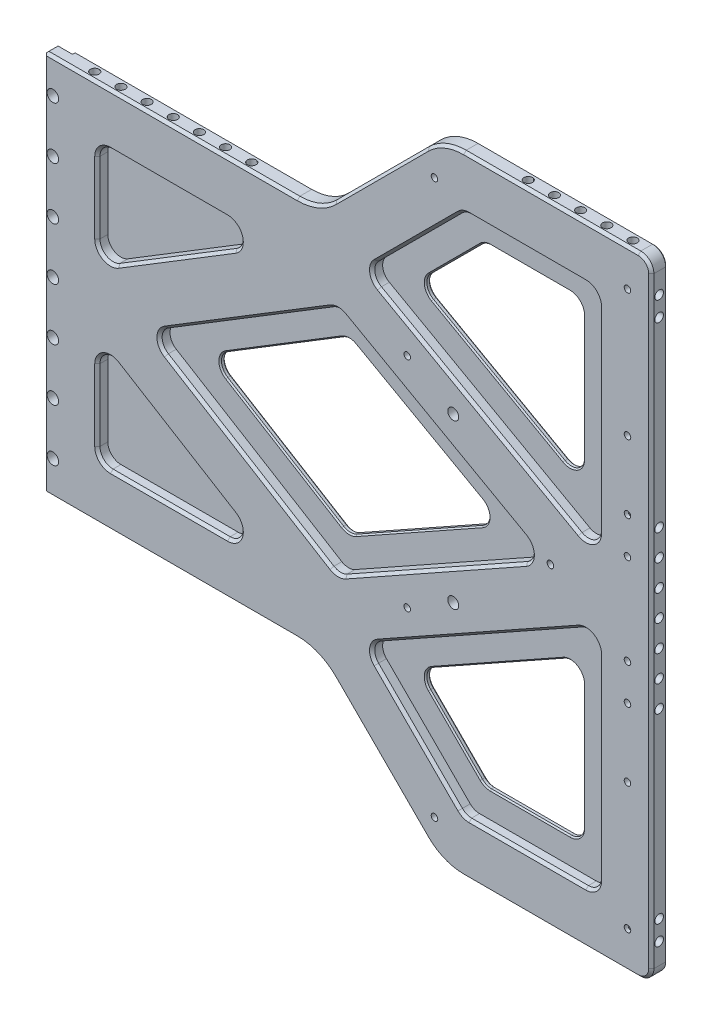
from build123d import *

# Parameters (mm, degrees)
EXTRUDE_1_DEPTH             = 1
EXTRUDE_2_DEPTH             = 5
FILLET_1_R                  = 20
CUT_EXTRUDE_1_DEPTH         = 4
FILLET_2_R                  = 5
CUT_EXTRUDE_2_DEPTH         = 5
FILLET_3_R                  = 5
FILLET_4_R                  = 5
CHAMFER_1_SIZE              = 1
CHAMFER_2_SIZE              = 1
CUT_EXTRUDE_3_DEPTH         = 266.872881163
CUT_EXTRUDE_3_DEPTH_BACK    = 266.872881163
SKETCH_5_R                  = 2.2
HOLE_WIZARD_M4_1_AT_2_COUNT = 2
HOLE_WIZARD_M4_1_AT_2_PITCH = 10
HOLE_WIZARD_M4_1_AT_3_COUNT = 2
HOLE_WIZARD_M4_1_AT_3_PITCH = 20
HOLE_WIZARD_M4_1_AT_4_COUNT = 2
HOLE_WIZARD_M4_1_AT_4_PITCH = 30
HOLE_WIZARD_M4_1_AT_5_COUNT = 2
HOLE_WIZARD_M4_1_AT_5_PITCH = 40
HOLE_WIZARD_M4_1_AT_6_COUNT = 2
HOLE_WIZARD_M4_1_AT_6_PITCH = 50
HOLE_WIZARD_M4_1_AT_7_COUNT = 2
HOLE_WIZARD_M4_1_AT_7_PITCH = 60
HOLE_WIZARD_M4_2_AT_2_COUNT = 2
HOLE_WIZARD_M4_2_AT_2_PITCH = 10
HOLE_WIZARD_M4_2_AT_3_COUNT = 2
HOLE_WIZARD_M4_2_AT_3_PITCH = 20
HOLE_WIZARD_M4_2_AT_4_COUNT = 2
HOLE_WIZARD_M4_2_AT_4_PITCH = 30
HOLE_WIZARD_M4_2_AT_5_COUNT = 2
HOLE_WIZARD_M4_2_AT_5_PITCH = 40
HOLE_WIZARD_M4_3_AT_2_COUNT = 2
HOLE_WIZARD_M4_3_AT_2_PITCH = 7.5
HOLE_WIZARD_M5_1_D          = 4.2
HOLE_WIZARD_M5_1_DEPTH      = 12.4
HOLE_WIZARD_M5_1_TIP        = 1.2618073
HOLE_WIZARD_M4_4_D          = 3.3
HOLE_WIZARD_M4_4_DEPTH      = 10.1
HOLE_WIZARD_M4_4_TIP        = 0.991420021
HOLE_WIZARD_M3_1_AT_2_COUNT = 2
HOLE_WIZARD_M3_1_AT_2_PITCH = 64.972623466
HOLE_WIZARD_M3_1_AT_3_COUNT = 2
HOLE_WIZARD_M3_1_AT_3_PITCH = 68.85714545
HOLE_WIZARD_M3_1_AT_4_COUNT = 2
HOLE_WIZARD_M3_1_AT_4_PITCH = 84.831082157
HOLE_WIZARD_M3_1_AT_5_COUNT = 2
HOLE_WIZARD_M3_1_AT_5_PITCH = 87.639356456
HOLE_WIZARD_M3_1_AT_6_COUNT = 2
HOLE_WIZARD_M3_1_AT_6_PITCH = 105.831054044
HOLE_WIZARD_M3_1_AT_7_COUNT = 2
HOLE_WIZARD_M3_1_AT_7_PITCH = 85.616918889
CHAMFER_3_SIZE              = 0.5
CHAMFER_5_SIZE              = 0.5


with BuildPart() as part:
    # 草图1 → 凸台-拉伸1 (new body)
    with BuildSketch(Plane.XY):
        Polygon((11.5, 73), (110.175860782, 73), (157.175860782, 120), (237.175860782, 120), (237.175860782, -120), (157.175860782, -120), (110.175860782, -73), (11.5, -73), align=None)
    extrude(amount=-EXTRUDE_1_DEPTH)

    # 草图2 → 凸台-拉伸2 (add)
    with BuildSketch(Plane.XY):
        Polygon((11.5, 73), (5.5, 73), (5.5, -73), (11.5, -73), (110.175860782, -73), (157.175860782, -120), (237.175860782, -120), (237.175860782, 120), (157.175860782, 120), (110.175860782, 73), align=None)
    extrude(amount=EXTRUDE_2_DEPTH)

    # 圆角1
    fillet_1_edges = [part.edges().sort_by_distance(p)[0] for p in [
        (110.175860782, 73, 2),
        (157.175860782, 120, 2),
        (157.175860782, -120, 2),
        (110.175860782, -73, 2),
    ]]
    fillet(fillet_1_edges, radius=FILLET_1_R)

    # 草图3 → 切除-拉伸1 (cut)
    with BuildSketch(Plane.XY.offset(5)):
        Polygon((196.725411073, 0), (117.41720526, -44.458394956), (44.675653042, 0), (117.41720526, 44.458394956), align=None)
        with BuildLine():
            Line((127.111323554, 61.952213992), (217.175860782, 11.464061769))
            Line((217.175860782, 11.464061769), (217.175860782, 100))
            Line((217.175860782, 100), (165.46013203, 100))
            Line((165.46013203, 100), (130.175860782, 64.715728753))
            ThreePointArc((130.175860782, 64.715728753), (128.679252709, 63.294426421), (127.111323554, 61.952213992))
        make_face()
        with BuildLine():
            Line((217.175860782, -100), (217.175860782, -11.464061769))
            Line((217.175860782, -11.464061769), (127.111323554, -61.952213992))
            ThreePointArc((127.111323554, -61.952213992), (128.679252709, -63.294426421), (130.175860782, -64.715728752))
            Line((130.175860782, -64.715728752), (165.46013203, -100))
            Line((165.46013203, -100), (217.175860782, -100))
        make_face()
        Polygon((25.5, -53), (93.041428657, -53), (25.5, -11.719831794), align=None)
        Polygon((25.5, 11.719831794), (93.041428657, 53), (25.5, 53), align=None)
    extrude(amount=-CUT_EXTRUDE_1_DEPTH, mode=Mode.SUBTRACT)

    # 圆角2
    fillet_2_edges = [part.edges().sort_by_distance(p)[0] for p in [
        (165.46013203, -100, 3),
        (217.175860782, -100, 3),
        (217.175860782, -11.464061769, 3),
        (127.111323554, -61.952213992, 3),
        (217.175860782, 11.464061769, 3),
        (165.46013203, 100, 3),
        (127.111323554, 61.952213992, 3),
        (117.41720526, 44.458394956, 3),
        (44.675653042, 0, 3),
        (117.41720526, -44.458394956, 3),
        (196.725411073, 0, 3),
        (25.5, -53, 3),
        (93.041428657, -53, 3),
        (25.5, -11.719831794, 3),
        (25.5, 53, 3),
        (25.5, 11.719831794, 3),
        (93.041428657, 53, 3),
        (217.175860782, 100, 3),
    ]]
    fillet(fillet_2_edges, radius=FILLET_2_R)

    # 草图4 → 切除-拉伸2 (cut)
    with BuildSketch(Plane.XY.offset(1)):
        Polygon((176.274961364, 0), (117.635483691, 32.871971212), (63.851306084, 0), (117.635483691, -32.871971212), align=None)
        Polygon((143.712370298, 64.110102645), (207.175860782, 28.533898438), (207.175860782, 90), (169.602267653, 90), align=None)
        Polygon((143.712370298, -64.110102644), (169.602267653, -90), (207.175860782, -90), (207.175860782, -28.533898438), align=None)
    extrude(amount=-CUT_EXTRUDE_2_DEPTH, mode=Mode.SUBTRACT)

    # 圆角3
    fillet_3_edges = [part.edges().sort_by_distance(p)[0] for p in [
        (143.712370298, -64.110102644, 0),
        (207.175860782, -28.533898438, 0),
        (207.175860782, -90, 0),
        (169.602267653, -90, 0),
        (143.712370298, 64.110102645, 0),
        (169.602267653, 90, 0),
        (207.175860782, 90, 0),
        (207.175860782, 28.533898438, 0),
        (176.274961364, 0, 0),
        (117.635483691, -32.871971212, 0),
        (63.851306084, 0, 0),
        (117.635483691, 32.871971212, 0),
    ]]
    fillet(fillet_3_edges, radius=FILLET_3_R)

    # 圆角4
    fillet_4_edges = [part.edges().sort_by_distance(p)[0] for p in [
        (237.175860782, 120, 2),
        (237.175860782, -120, 2),
    ]]
    fillet(fillet_4_edges, radius=FILLET_4_R)

    # 倒角1
    chamfer_1_edges = [part.edges().sort_by_distance(p)[0] for p in [
        (189.853530312, -100, 5),
        (147.984212406, -82.524080377, 5),
        (217.175860782, -57.499490052, 5),
        (171.397142773, -37.126580608, 5),
        (217.175860782, 57.499490052, 5),
        (171.397142773, 37.126580608, 5),
        (147.984212406, 82.524080377, 5),
        (189.853530312, 100, 5),
        (83.287438892, 23.598864376, 5),
        (154.458199356, 23.694047456, 5),
        (83.287438892, -23.598864376, 5),
        (154.458199356, -23.694047456, 5),
        (52.886372686, -53, 5),
        (25.5, -34.317831169, 5),
        (55.493845813, -30.051558335, 5),
        (25.5, 34.317831169, 5),
        (52.886372686, 53, 5),
        (55.493845813, 30.051558335, 5),
        (165.61778268, -99.619397663, 5),
        (215.711394688, -98.535533906, 5),
        (214.703243811, -15.684778552, 5),
        (130.555302658, -62.293068947, 5),
        (214.703243811, 15.684778552, 5),
        (165.61778268, 99.619397663, 5),
        (130.555302658, 62.293068948, 5),
        (117.432165413, 43.664296036, 5),
        (49.263479563, 0, 5),
        (117.432165413, -43.664296036, 5),
        (191.500186218, 0, 5),
        (26.964466094, -51.535533906, 5),
        (80.08581945, -49.354369933, 5),
        (28.054326845, -16.274620854, 5),
        (26.964466094, 51.535533906, 5),
        (28.054326845, 16.274620854, 5),
        (80.085819451, 49.354369933, 5),
        (215.711394688, 98.535533906, 5),
    ]]
    chamfer(chamfer_1_edges, length=CHAMFER_1_SIZE)

    # 倒角2
    chamfer_2_edges = [part.edges().sort_by_distance(p)[0] for p in [
        (53.695794767, -73, 5),
        (237.175860782, 0, 5),
        (198.817996406, 120, 5),
        (235.711394688, -118.535533906, 5),
        (235.711394688, 118.535533906, 5),
        (56.695794768, 73, 5),
        (133.675860782, -96.5, 5),
        (198.817996406, -120, 5),
        (133.675860782, 96.5, 5),
        (157.806463382, -118.47759065, 5),
        (157.806463382, 118.47759065, 5),
        (109.545258182, -74.52240935, 5),
        (109.545258182, 74.52240935, 5),
    ]]
    chamfer(chamfer_2_edges, length=CHAMFER_2_SIZE)

    # 草图5 → 切除-拉伸3 (cut, two sides: drawn at the far end of the back side and taken through both)
    with BuildSketch(Plane.XY.offset(5).offset(-CUT_EXTRUDE_3_DEPTH_BACK)):
        with Locations((8.5, 60)):
            Circle(SKETCH_5_R)
        with Locations((8.5, 40)):
            Circle(SKETCH_5_R)
        with Locations((8.5, 20)):
            Circle(SKETCH_5_R)
        with Locations((8.5, 0)):
            Circle(SKETCH_5_R)
        with Locations((8.5, -20)):
            Circle(SKETCH_5_R)
        with Locations((8.5, -40)):
            Circle(SKETCH_5_R)
        with Locations((8.5, -60)):
            Circle(SKETCH_5_R)
    extrude(amount=CUT_EXTRUDE_3_DEPTH + CUT_EXTRUDE_3_DEPTH_BACK, mode=Mode.SUBTRACT)

    # 草图8 → M4 螺纹孔1 (revolve, cut)
    with BuildSketch(Plane(origin=(81.5, -73, 2), x_dir=(0, 0, -1), z_dir=(1, 0, 0))):
        Polygon((0, 0), (0, 11.091420021), (1.65, 10.1), (1.65, 0), align=None)
    hole_wizard_m4_1 = revolve(axis=Axis((81.5, -79.35, 2), (0, 1, 0)), mode=Mode.SUBTRACT)

    # M4 螺纹孔1 at 2: M4 螺纹孔1 ×2
    with Locations(*[(-i * HOLE_WIZARD_M4_1_AT_2_PITCH, 0, 0) for i in range(1, HOLE_WIZARD_M4_1_AT_2_COUNT)]):
        add(hole_wizard_m4_1, mode=Mode.SUBTRACT)

    # M4 螺纹孔1 at 3: M4 螺纹孔1 ×2
    with Locations(*[(-i * HOLE_WIZARD_M4_1_AT_3_PITCH, 0, 0) for i in range(1, HOLE_WIZARD_M4_1_AT_3_COUNT)]):
        add(hole_wizard_m4_1, mode=Mode.SUBTRACT)

    # M4 螺纹孔1 at 4: M4 螺纹孔1 ×2
    with Locations(*[(-i * HOLE_WIZARD_M4_1_AT_4_PITCH, 0, 0) for i in range(1, HOLE_WIZARD_M4_1_AT_4_COUNT)]):
        add(hole_wizard_m4_1, mode=Mode.SUBTRACT)

    # M4 螺纹孔1 at 5: M4 螺纹孔1 ×2
    with Locations(*[(-i * HOLE_WIZARD_M4_1_AT_5_PITCH, 0, 0) for i in range(1, HOLE_WIZARD_M4_1_AT_5_COUNT)]):
        add(hole_wizard_m4_1, mode=Mode.SUBTRACT)

    # M4 螺纹孔1 at 6: M4 螺纹孔1 ×2
    with Locations(*[(-i * HOLE_WIZARD_M4_1_AT_6_PITCH, 0, 0) for i in range(1, HOLE_WIZARD_M4_1_AT_6_COUNT)]):
        add(hole_wizard_m4_1, mode=Mode.SUBTRACT)

    # M4 螺纹孔1 at 7: M4 螺纹孔1 ×2
    with Locations(*[(-i * HOLE_WIZARD_M4_1_AT_7_PITCH, 0, 0) for i in range(1, HOLE_WIZARD_M4_1_AT_7_COUNT)]):
        add(hole_wizard_m4_1, mode=Mode.SUBTRACT)

    # 镜向1: M4 螺纹孔1 across plane
    add(hole_wizard_m4_1.mirror(Plane.ZX), mode=Mode.SUBTRACT)

    # 镜向1 copy 1 sketch → 镜向1 copy 1 (revolve, cut)
    with BuildSketch(Plane(origin=(71.5, 73, 2), x_dir=(0, 0, -1), z_dir=(1, 0, 0))):
        Polygon((0, 0), (0, -11.091420021), (1.65, -10.1), (1.65, 0), align=None)
    revolve(axis=Axis((71.5, 79.35, 2), (0, 1, 0)), mode=Mode.SUBTRACT)

    # 镜向1 copy 2 sketch → 镜向1 copy 2 (revolve, cut)
    with BuildSketch(Plane(origin=(61.5, 73, 2), x_dir=(0, 0, -1), z_dir=(1, 0, 0))):
        Polygon((0, 0), (0, -11.091420021), (1.65, -10.1), (1.65, 0), align=None)
    revolve(axis=Axis((61.5, 79.35, 2), (0, 1, 0)), mode=Mode.SUBTRACT)

    # 镜向1 copy 3 sketch → 镜向1 copy 3 (revolve, cut)
    with BuildSketch(Plane(origin=(51.5, 73, 2), x_dir=(0, 0, -1), z_dir=(1, 0, 0))):
        Polygon((0, 0), (0, -11.091420021), (1.65, -10.1), (1.65, 0), align=None)
    revolve(axis=Axis((51.5, 79.35, 2), (0, 1, 0)), mode=Mode.SUBTRACT)

    # 镜向1 copy 4 sketch → 镜向1 copy 4 (revolve, cut)
    with BuildSketch(Plane(origin=(41.5, 73, 2), x_dir=(0, 0, -1), z_dir=(1, 0, 0))):
        Polygon((0, 0), (0, -11.091420021), (1.65, -10.1), (1.65, 0), align=None)
    revolve(axis=Axis((41.5, 79.35, 2), (0, 1, 0)), mode=Mode.SUBTRACT)

    # 镜向1 copy 5 sketch → 镜向1 copy 5 (revolve, cut)
    with BuildSketch(Plane(origin=(31.5, 73, 2), x_dir=(0, 0, -1), z_dir=(1, 0, 0))):
        Polygon((0, 0), (0, -11.091420021), (1.65, -10.1), (1.65, 0), align=None)
    revolve(axis=Axis((31.5, 79.35, 2), (0, 1, 0)), mode=Mode.SUBTRACT)

    # 镜向1 copy 6 sketch → 镜向1 copy 6 (revolve, cut)
    with BuildSketch(Plane(origin=(21.5, 73, 2), x_dir=(0, 0, -1), z_dir=(1, 0, 0))):
        Polygon((0, 0), (0, -11.091420021), (1.65, -10.1), (1.65, 0), align=None)
    revolve(axis=Axis((21.5, 79.35, 2), (0, 1, 0)), mode=Mode.SUBTRACT)

    # 草图11 → M4 螺纹孔2 (revolve, cut)
    with BuildSketch(Plane(origin=(227.175860782, -120, 2), x_dir=(0, 0, -1), z_dir=(1, 0, 0))):
        Polygon((0, 0), (0, 11.091420021), (1.65, 10.1), (1.65, 0), align=None)
    hole_wizard_m4_2 = revolve(axis=Axis((227.175860782, -126.35, 2), (0, 1, 0)), mode=Mode.SUBTRACT)

    # M4 螺纹孔2 at 2: M4 螺纹孔2 ×2
    with Locations(*[(-i * HOLE_WIZARD_M4_2_AT_2_PITCH, 0, 0) for i in range(1, HOLE_WIZARD_M4_2_AT_2_COUNT)]):
        add(hole_wizard_m4_2, mode=Mode.SUBTRACT)

    # M4 螺纹孔2 at 3: M4 螺纹孔2 ×2
    with Locations(*[(-i * HOLE_WIZARD_M4_2_AT_3_PITCH, 0, 0) for i in range(1, HOLE_WIZARD_M4_2_AT_3_COUNT)]):
        add(hole_wizard_m4_2, mode=Mode.SUBTRACT)

    # M4 螺纹孔2 at 4: M4 螺纹孔2 ×2
    with Locations(*[(-i * HOLE_WIZARD_M4_2_AT_4_PITCH, 0, 0) for i in range(1, HOLE_WIZARD_M4_2_AT_4_COUNT)]):
        add(hole_wizard_m4_2, mode=Mode.SUBTRACT)

    # M4 螺纹孔2 at 5: M4 螺纹孔2 ×2
    with Locations(*[(-i * HOLE_WIZARD_M4_2_AT_5_PITCH, 0, 0) for i in range(1, HOLE_WIZARD_M4_2_AT_5_COUNT)]):
        add(hole_wizard_m4_2, mode=Mode.SUBTRACT)

    # 镜向2: M4 螺纹孔2 across plane
    add(hole_wizard_m4_2.mirror(Plane.ZX), mode=Mode.SUBTRACT)

    # 镜向2 copy 1 sketch → 镜向2 copy 1 (revolve, cut)
    with BuildSketch(Plane(origin=(217.175860782, 120, 2), x_dir=(0, 0, -1), z_dir=(1, 0, 0))):
        Polygon((0, 0), (0, -11.091420021), (1.65, -10.1), (1.65, 0), align=None)
    revolve(axis=Axis((217.175860782, 126.35, 2), (0, 1, 0)), mode=Mode.SUBTRACT)

    # 镜向2 copy 2 sketch → 镜向2 copy 2 (revolve, cut)
    with BuildSketch(Plane(origin=(207.175860782, 120, 2), x_dir=(0, 0, -1), z_dir=(1, 0, 0))):
        Polygon((0, 0), (0, -11.091420021), (1.65, -10.1), (1.65, 0), align=None)
    revolve(axis=Axis((207.175860782, 126.35, 2), (0, 1, 0)), mode=Mode.SUBTRACT)

    # 镜向2 copy 3 sketch → 镜向2 copy 3 (revolve, cut)
    with BuildSketch(Plane(origin=(197.175860782, 120, 2), x_dir=(0, 0, -1), z_dir=(1, 0, 0))):
        Polygon((0, 0), (0, -11.091420021), (1.65, -10.1), (1.65, 0), align=None)
    revolve(axis=Axis((197.175860782, 126.35, 2), (0, 1, 0)), mode=Mode.SUBTRACT)

    # 镜向2 copy 4 sketch → 镜向2 copy 4 (revolve, cut)
    with BuildSketch(Plane(origin=(187.175860782, 120, 2), x_dir=(0, 0, -1), z_dir=(1, 0, 0))):
        Polygon((0, 0), (0, -11.091420021), (1.65, -10.1), (1.65, 0), align=None)
    revolve(axis=Axis((187.175860782, 126.35, 2), (0, 1, 0)), mode=Mode.SUBTRACT)

    # 草图14 → M4 螺纹孔3 (revolve, cut)
    with BuildSketch(Plane(origin=(237.175860782, -99.5, 2), x_dir=(0, 0, -1), z_dir=(0, 1, 0))):
        Polygon((0, 0), (0, 11.091420021), (1.65, 10.1), (1.65, 0), align=None)
    hole_wizard_m4_3 = revolve(axis=Axis((243.525860782, -99.5, 2), (-1, 0, 0)), mode=Mode.SUBTRACT)

    # M4 螺纹孔3 at 2: M4 螺纹孔3 ×2
    with Locations(*[(0, -i * HOLE_WIZARD_M4_3_AT_2_PITCH, 0) for i in range(1, HOLE_WIZARD_M4_3_AT_2_COUNT)]):
        add(hole_wizard_m4_3, mode=Mode.SUBTRACT)

    # 镜向3: M4 螺纹孔3 across plane
    add(hole_wizard_m4_3.mirror(Plane.ZX), mode=Mode.SUBTRACT)

    # 镜向3 copy 1 sketch → 镜向3 copy 1 (revolve, cut)
    with BuildSketch(Plane(origin=(237.175860782, 107, 2), x_dir=(0, 0, -1), z_dir=(0, -1, 0))):
        Polygon((0, 0), (0, -11.091420021), (1.65, -10.1), (1.65, 0), align=None)
    revolve(axis=Axis((243.525860782, 107, 2), (1, 0, 0)), mode=Mode.SUBTRACT)

    # M5 螺纹孔1
    with Locations(Plane.XY.offset(5)):
        with Locations((161.5, 31.210634294), (161.5, -31.210634294)):
            Hole(HOLE_WIZARD_M5_1_D / 2, depth=HOLE_WIZARD_M5_1_DEPTH)
            with Locations((0, 0, -(HOLE_WIZARD_M5_1_DEPTH + HOLE_WIZARD_M5_1_TIP / 2))):  # 118° drill point
                Cone(0, HOLE_WIZARD_M5_1_D / 2, HOLE_WIZARD_M5_1_TIP, mode=Mode.SUBTRACT)

    # M4 螺纹孔4
    with Locations(Plane(origin=(237.175860782, 0, 0), x_dir=(0, 0, -1), z_dir=(1, 0, 0))):
        with Locations((-2, 30), (-2, 20), (-2, 10), (-2, 0), (-2, -10), (-2, -20), (-2, -30)):
            Hole(HOLE_WIZARD_M4_4_D / 2, depth=HOLE_WIZARD_M4_4_DEPTH)
            with Locations((0, 0, -(HOLE_WIZARD_M4_4_DEPTH + HOLE_WIZARD_M4_4_TIP / 2))):  # 118° drill point
                Cone(0, HOLE_WIZARD_M4_4_D / 2, HOLE_WIZARD_M4_4_TIP, mode=Mode.SUBTRACT)

    # 草图23 → M3 螺纹孔1 (revolve, cut)
    with BuildSketch(Plane(origin=(143.9, -41.700634294, 5), x_dir=(0, -1, 0), z_dir=(1, 0, 0))):
        Polygon((0, 0), (0, 8.251075774), (1.25, 7.5), (1.25, 0), align=None)
    hole_wizard_m3_1 = revolve(axis=Axis((143.9, -41.700634294, 11.35), (0, 0, -1)), mode=Mode.SUBTRACT)

    # M3 螺纹孔1 at 2: M3 螺纹孔1 ×2
    with Locations(*[Vector(0.1605291497198888, -0.98703109985968, 0) * (i * HOLE_WIZARD_M3_1_AT_2_PITCH) for i in range(1, HOLE_WIZARD_M3_1_AT_2_COUNT)]):
        add(hole_wizard_m3_1, mode=Mode.SUBTRACT)

    # M3 螺纹孔1 at 3: M3 螺纹孔1 ×2
    with Locations(*[Vector(0.7949792231794381, 0.606636657904068, 0) * (i * HOLE_WIZARD_M3_1_AT_3_PITCH) for i in range(1, HOLE_WIZARD_M3_1_AT_3_COUNT)]):
        add(hole_wizard_m3_1, mode=Mode.SUBTRACT)

    # M3 螺纹孔1 at 4: M3 螺纹孔1 ×2
    with Locations(*[Vector(0.9923249575407045, 0.12365750540035624, 0) * (i * HOLE_WIZARD_M3_1_AT_4_PITCH) for i in range(1, HOLE_WIZARD_M3_1_AT_4_COUNT)]):
        add(hole_wizard_m3_1, mode=Mode.SUBTRACT)

    # M3 螺纹孔1 at 5: M3 螺纹孔1 ×2
    with Locations(*[Vector(0.960527363552502, 0.2781855205917082, 0) * (i * HOLE_WIZARD_M3_1_AT_5_PITCH) for i in range(1, HOLE_WIZARD_M3_1_AT_5_COUNT)]):
        add(hole_wizard_m3_1, mode=Mode.SUBTRACT)

    # M3 螺纹孔1 at 6: M3 螺纹孔1 ×2
    with Locations(*[Vector(0.7954187054136518, -0.6060602965696321, 0) * (i * HOLE_WIZARD_M3_1_AT_6_PITCH) for i in range(1, HOLE_WIZARD_M3_1_AT_6_COUNT)]):
        add(hole_wizard_m3_1, mode=Mode.SUBTRACT)

    # M3 螺纹孔1 at 7: M3 螺纹孔1 ×2
    with Locations(*[Vector(0.9832168815768637, -0.18244057603029953, 0) * (i * HOLE_WIZARD_M3_1_AT_7_PITCH) for i in range(1, HOLE_WIZARD_M3_1_AT_7_COUNT)]):
        add(hole_wizard_m3_1, mode=Mode.SUBTRACT)

    # 镜向4: M3 螺纹孔1 across plane
    add(hole_wizard_m3_1.mirror(Plane.ZX), mode=Mode.SUBTRACT)

    # 镜向4 copy 1 sketch → 镜向4 copy 1 (revolve, cut)
    with BuildSketch(Plane(origin=(154.33, 105.830634294, 5), x_dir=(0, 1, 0), z_dir=(1, 0, 0))):
        Polygon((0, 0), (0, -8.251075774), (1.25, -7.5), (1.25, 0), align=None)
    revolve(axis=Axis((154.33, 105.830634294, 11.35), (0, 0, 1)), mode=Mode.SUBTRACT)

    # 镜向4 copy 2 sketch → 镜向4 copy 2 (revolve, cut)
    with BuildSketch(Plane(origin=(198.64, -0.070634294, 5), x_dir=(0, 1, 0), z_dir=(1, 0, 0))):
        Polygon((0, 0), (0, -8.251075774), (1.25, -7.5), (1.25, 0), align=None)
    revolve(axis=Axis((198.64, -0.070634294, 11.35), (0, 0, 1)), mode=Mode.SUBTRACT)

    # 镜向4 copy 3 sketch → 镜向4 copy 3 (revolve, cut)
    with BuildSketch(Plane(origin=(228.08, 31.210634294, 5), x_dir=(0, 1, 0), z_dir=(1, 0, 0))):
        Polygon((0, 0), (0, -8.251075774), (1.25, -7.5), (1.25, 0), align=None)
    revolve(axis=Axis((228.08, 31.210634294, 11.35), (0, 0, 1)), mode=Mode.SUBTRACT)

    # 镜向4 copy 4 sketch → 镜向4 copy 4 (revolve, cut)
    with BuildSketch(Plane(origin=(228.08, 17.320634294, 5), x_dir=(0, 1, 0), z_dir=(1, 0, 0))):
        Polygon((0, 0), (0, -8.251075774), (1.25, -7.5), (1.25, 0), align=None)
    revolve(axis=Axis((228.08, 17.320634294, 11.35), (0, 0, 1)), mode=Mode.SUBTRACT)

    # 镜向4 copy 5 sketch → 镜向4 copy 5 (revolve, cut)
    with BuildSketch(Plane(origin=(228.08, 105.840634294, 5), x_dir=(0, 1, 0), z_dir=(1, 0, 0))):
        Polygon((0, 0), (0, -8.251075774), (1.25, -7.5), (1.25, 0), align=None)
    revolve(axis=Axis((228.08, 105.840634294, 11.35), (0, 0, 1)), mode=Mode.SUBTRACT)

    # 镜向4 copy 6 sketch → 镜向4 copy 6 (revolve, cut)
    with BuildSketch(Plane(origin=(228.08, 57.320634294, 5), x_dir=(0, 1, 0), z_dir=(1, 0, 0))):
        Polygon((0, 0), (0, -8.251075774), (1.25, -7.5), (1.25, 0), align=None)
    revolve(axis=Axis((228.08, 57.320634294, 11.35), (0, 0, 1)), mode=Mode.SUBTRACT)

    # 倒角3
    chamfer_3_edges = [part.edges().sort_by_distance(p)[0] for p in [
        (92.984404628, -17.805652504, 1),
        (92.984404628, -17.805652504, -1),
        (92.984404628, 17.805652504, 1),
        (92.984404628, 17.805652504, -1),
        (144.342113717, 17.900835584, 1),
        (144.342113717, 17.900835584, -1),
        (144.342113717, -17.900835584, 1),
        (144.342113717, -17.900835584, -1),
        (186.924598124, 90, 1),
        (186.924598124, 90, -1),
        (207.175860782, 61.034408386, 1),
        (207.175860782, 61.034408386, -1),
        (174.601220288, 46.794508646, 1),
        (174.601220288, 46.794508646, -1),
        (158.259357733, 78.65709008, 1),
        (158.259357733, 78.65709008, -1),
        (207.175860782, -61.034408386, 1),
        (207.175860782, -61.034408386, -1),
        (186.924598124, -90, 1),
        (186.924598124, -90, -1),
        (158.259357733, -78.65709008, 1),
        (158.259357733, -78.65709008, -1),
        (174.601220288, -46.794508646, 1),
        (174.601220288, -46.794508646, -1),
        (68.439132604, 0, 1),
        (68.439132604, 0, -1),
        (117.650443844, 32.077872292, 1),
        (117.650443844, 32.077872292, -1),
        (171.049736509, 0, 1),
        (171.049736509, 0, -1),
        (117.650443843, -32.077872292, 1),
        (117.650443843, -32.077872292, -1),
        (205.711394688, 88.535533906, 1),
        (205.711394688, 88.535533906, -1),
        (204.703243811, 32.754615222, 1),
        (204.703243811, 32.754615222, -1),
        (169.759918303, 89.619397663, 1),
        (169.759918303, 89.619397663, -1),
        (205.711394688, -88.535533906, 1),
        (205.711394688, -88.535533906, -1),
        (169.759918303, -89.619397663, 1),
        (169.759918303, -89.619397663, -1),
        (146.963457688, -64.559088353, 1),
        (146.963457688, -64.559088353, -1),
        (204.703243811, -32.754615222, 1),
        (204.703243811, -32.754615222, -1),
        (146.963457688, 64.559088353, 1),
        (146.963457688, 64.559088353, -1),
    ]]
    chamfer(chamfer_3_edges, length=CHAMFER_3_SIZE)

    # 倒角4
    # the kernel refuses this chamfer: 0.5 mm, written as the material it takes off along each edge
    with BuildSketch(Plane(origin=(5.833333334, 72.666666667, 0.333333333), x_dir=(0.7071067811889635, 0.7071067811841314, 0), z_dir=(-0.5773502691869986, 0.5773502691909438, -0.5773502691909348))) as chamfer_4_piece_1:
        Polygon((-0.353553391, -0.204124145), (0.353553391, -0.204124145), (0, 0.40824829), align=None)
    extrude(amount=0.635085296, mode=Mode.SUBTRACT)
    with BuildSketch(Plane(origin=(5.833333334, -72.666666667, 0.333333333), x_dir=(0.7071067811865991, -0.7071067811864961, 0), z_dir=(-0.5773502691895952, -0.5773502691896788, -0.5773502691896033))) as chamfer_4_piece_2:
        Polygon((-0.353553391, 0.204124145), (0.353553391, 0.204124145), (0, -0.40824829), align=None)
    extrude(amount=0.635085296, mode=Mode.SUBTRACT)
    with BuildSketch(Plane(origin=(11.5, 73, 0), x_dir=(1.876854023712596e-13, 0.027495876610582174, 0.9996219169112968), z_dir=(-1.0, 6.825947214900805e-12, 0)), Plane(origin=(4.214158506, -73, 0), x_dir=(0, -0.027495876610582174, 0.9996219169112968), z_dir=(1, 0, 0))) as chamfer_4_piece_3:
        with BuildLine():
            Line((0.514336598, 0), (-0.028273577, -0.513558897))
            Line((-0.028273577, -0.513558897), (-0.038269797, -0.513283938))
            ThreePointArc((-0.038269797, -0.513283938), (-0.017064614, -0.256698915), (-0.009996219, 0.000274959))
            Line((-0.009996219, 0.000274959), (0.000274959, 0.009996219))
            ThreePointArc((0.000274959, 0.009996219), (0.257248832, 0.002927825), (0.514611556, 0.009996219))
            Line((0.514611556, 0.009996219), (0.514336598, 0))
        make_face()
    extrude(amount=7.285841494, mode=Mode.SUBTRACT)
    with BuildSketch(Plane(origin=(5.5, 74.285841494, 0), x_dir=(0.9996219169112968, -9.790593214249419e-15, -0.027495876610585952), z_dir=(0, -1, 0))) as chamfer_4_piece_4:
        with BuildLine():
            Line((0.514336598, 0), (-0.028273577, 0.513558897))
            Line((-0.028273577, 0.513558897), (-0.038269797, 0.513283938))
            ThreePointArc((-0.038269797, 0.513283938), (-0.017064614, 0.256698915), (-0.009996219, -0.000274959))
            Line((-0.009996219, -0.000274959), (0.000274959, -0.009996219))
            ThreePointArc((0.000274959, -0.009996219), (0.257248832, -0.002927825), (0.514611556, -0.009996219))
            Line((0.514611556, -0.009996219), (0.514336598, 0))
        make_face()
    extrude(amount=148.571682988, mode=Mode.SUBTRACT)
    with BuildSketch(Plane(origin=(237.175860782, 115, -1), x_dir=(-0.9996219169112968, 0, -0.027495876610586605), z_dir=(0, -1, 0))) as chamfer_4_piece_5:
        with BuildLine():
            Line((0.514336598, 0), (-0.028273577, -0.513558897))
            Line((-0.028273577, -0.513558897), (-0.038269797, -0.513283938))
            ThreePointArc((-0.038269797, -0.513283938), (-0.017064614, -0.256698915), (-0.009996219, 0.000274959))
            Line((-0.009996219, 0.000274959), (0.000274959, 0.009996219))
            ThreePointArc((0.000274959, 0.009996219), (0.257248832, 0.002927825), (0.514611556, 0.009996219))
            Line((0.514611556, 0.009996219), (0.514336598, 0))
        make_face()
    extrude(amount=230, mode=Mode.SUBTRACT)
    with BuildSketch(Plane(origin=(165.46013203, 120, -1), x_dir=(0, -0.9996219169112968, -0.027495876610586605), z_dir=(1, 0, 0)), Plane(origin=(232.175860782, -120, -1), x_dir=(0, 0.9996219169112968, -0.027495876610586605), z_dir=(-1, 0, 0))) as chamfer_4_piece_6:
        with BuildLine():
            Line((0.514336598, 0), (-0.028273577, -0.513558897))
            Line((-0.028273577, -0.513558897), (-0.038269797, -0.513283938))
            ThreePointArc((-0.038269797, -0.513283938), (-0.017064614, -0.256698915), (-0.009996219, 0.000274959))
            Line((-0.009996219, 0.000274959), (0.000274959, 0.009996219))
            ThreePointArc((0.000274959, 0.009996219), (0.257248832, 0.002927825), (0.514611556, 0.009996219))
            Line((0.514611556, 0.009996219), (0.514336598, 0))
        make_face()
    extrude(amount=66.715728753, mode=Mode.SUBTRACT)
    with BuildSketch(Plane(origin=(232.175860782, -115, -1), x_dir=(1, 0, 0), z_dir=(0, 1, 0))) as chamfer_4_piece_7:
        with BuildLine():
            Line((4.485857864, 0.014142136), (5.014142136, -0.514142136))
            Line((5.014142136, -0.514142136), (5.024142136, -0.514142136))
            ThreePointArc((5.024142136, -0.514142136), (5.01, -0.257071068), (5.01, 0))
            Line((5.01, 0), (5, 0.01))
            ThreePointArc((5, 0.01), (4.742928932, 0.01), (4.485857864, 0.024142136))
            Line((4.485857864, 0.024142136), (4.485857864, 0.014142136))
        make_face()
    revolve(axis=Axis((232.175860782, -115, -1), (0, 0, -1)), revolution_arc=90, mode=Mode.SUBTRACT)
    with BuildSketch(Plane(origin=(232.175860782, 115, -1), x_dir=(0, 1, 0), z_dir=(-1, 0, 0))) as chamfer_4_piece_8:
        with BuildLine():
            Line((4.485857864, 0.014142136), (5.014142136, -0.514142136))
            Line((5.014142136, -0.514142136), (5.024142136, -0.514142136))
            ThreePointArc((5.024142136, -0.514142136), (5.01, -0.257071068), (5.01, 0))
            Line((5.01, 0), (5, 0.01))
            ThreePointArc((5, 0.01), (4.742928932, 0.01), (4.485857864, 0.024142136))
            Line((4.485857864, 0.024142136), (4.485857864, 0.014142136))
        make_face()
    revolve(axis=Axis((232.175860782, 115, -1), (0, 0, -1)), revolution_arc=90, mode=Mode.SUBTRACT)
    with BuildSketch(Plane(origin=(5.5, -73, -1.285841494), x_dir=(0.999621916911297, -0.0274958766105822, 0), z_dir=(0, 0, 1))) as chamfer_4_piece_9:
        with BuildLine():
            Line((0.514336598, 0), (-0.028273577, 0.513558897))
            Line((-0.028273577, 0.513558897), (-0.038269797, 0.513283938))
            ThreePointArc((-0.038269797, 0.513283938), (-0.017064614, 0.256698915), (-0.009996219, -0.000274959))
            Line((-0.009996219, -0.000274959), (0.000274959, -0.009996219))
            ThreePointArc((0.000274959, -0.009996219), (0.257248832, -0.002927825), (0.514611556, -0.009996219))
            Line((0.514611556, -0.009996219), (0.514336598, 0))
        make_face()
    extrude(amount=6.571682988, mode=Mode.SUBTRACT)
    with BuildSketch(Plane(origin=(5.5, 73, -1.285841494), x_dir=(0.9996219169114815, 0.02749587660387065, 0), z_dir=(0, 0, 1))) as chamfer_4_piece_10:
        with BuildLine():
            Line((0.514336598, 0), (-0.028273577, -0.513558897))
            Line((-0.028273577, -0.513558897), (-0.038269797, -0.513283938))
            ThreePointArc((-0.038269797, -0.513283938), (-0.017064614, -0.256698915), (-0.009996219, 0.000274959))
            Line((-0.009996219, 0.000274959), (0.000274959, 0.009996219))
            ThreePointArc((0.000274959, 0.009996219), (0.257248832, 0.002927825), (0.514611556, 0.009996219))
            Line((0.514611556, 0.009996219), (0.514336598, 0))
        make_face()
    extrude(amount=6.571682988, mode=Mode.SUBTRACT)
    with BuildSketch(Plane(origin=(116.033725159, 78.857864376, -1), x_dir=(0.7068394360706732, -0.7068394360706737, -0.027495876610585456), z_dir=(0.7071067811865478, 0.7071067811865474, 0))) as chamfer_4_piece_11:
        with BuildLine():
            Line((0.514336598, 0), (-0.028273577, -0.513558897))
            Line((-0.028273577, -0.513558897), (-0.038269797, -0.513283938))
            ThreePointArc((-0.038269797, -0.513283938), (-0.017064614, -0.256698915), (-0.009996219, 0.000274959))
            Line((-0.009996219, 0.000274959), (0.000274959, 0.009996219))
            ThreePointArc((0.000274959, 0.009996219), (0.257248832, 0.002927825), (0.514611556, 0.009996219))
            Line((0.514611556, 0.009996219), (0.514336598, 0))
        make_face()
    extrude(amount=49.899494936, mode=Mode.SUBTRACT)
    with BuildSketch(Plane(origin=(10.214158506, 73, -1), x_dir=(0, -0.9996219169112968, -0.027495876610586605), z_dir=(1, 0, 0)), Plane(origin=(101.891589535, -73, -1), x_dir=(0, 0.9996219169112968, -0.027495876610586605), z_dir=(-1, 0, 0))) as chamfer_4_piece_12:
        with BuildLine():
            Line((0.514336598, 0), (-0.028273577, -0.513558897))
            Line((-0.028273577, -0.513558897), (-0.038269797, -0.513283938))
            ThreePointArc((-0.038269797, -0.513283938), (-0.017064614, -0.256698915), (-0.009996219, 0.000274959))
            Line((-0.009996219, 0.000274959), (0.000274959, 0.009996219))
            ThreePointArc((0.000274959, 0.009996219), (0.257248832, 0.002927825), (0.514611556, 0.009996219))
            Line((0.514611556, 0.009996219), (0.514336598, 0))
        make_face()
    extrude(amount=91.677431028, mode=Mode.SUBTRACT)
    with BuildSketch(Plane(origin=(151.317996406, -114.142135624, -1), x_dir=(0.7068394360706737, 0.7068394360706735, -0.027495876610585994), z_dir=(-0.7071067811865475, 0.7071067811865477, 0))) as chamfer_4_piece_13:
        with BuildLine():
            Line((0.514336598, 0), (-0.028273577, -0.513558897))
            Line((-0.028273577, -0.513558897), (-0.038269797, -0.513283938))
            ThreePointArc((-0.038269797, -0.513283938), (-0.017064614, -0.256698915), (-0.009996219, 0.000274959))
            Line((-0.009996219, 0.000274959), (0.000274959, 0.009996219))
            ThreePointArc((0.000274959, 0.009996219), (0.257248832, 0.002927825), (0.514611556, 0.009996219))
            Line((0.514611556, 0.009996219), (0.514336598, 0))
        make_face()
    extrude(amount=49.899494937, mode=Mode.SUBTRACT)
    with BuildSketch(Plane(origin=(165.46013203, -100, -1), x_dir=(-0.7071067811865476, -0.7071067811865476, 0), z_dir=(-0.7071067811865476, 0.7071067811865476, 0))) as chamfer_4_piece_14:
        with BuildLine():
            Line((19.485857864, -0.014142136), (20.014142136, 0.514142136))
            Line((20.014142136, 0.514142136), (20.024142136, 0.514142136))
            ThreePointArc((20.024142136, 0.514142136), (20.01, 0.257071068), (20.01, 0))
            Line((20.01, 0), (20, -0.01))
            ThreePointArc((20, -0.01), (19.742928932, -0.01), (19.485857864, -0.024142136))
            Line((19.485857864, -0.024142136), (19.485857864, -0.014142136))
        make_face()
    revolve(axis=Axis((165.46013203, -100, -1), (0, 0, 1)), revolution_arc=45, mode=Mode.SUBTRACT)
    with BuildSketch(Plane(origin=(165.46013203, 100, -1), x_dir=(0, 1, 0), z_dir=(1, 0, 0))) as chamfer_4_piece_15:
        with BuildLine():
            Line((19.485857864, -0.014142136), (20.014142136, 0.514142136))
            Line((20.014142136, 0.514142136), (20.024142136, 0.514142136))
            ThreePointArc((20.024142136, 0.514142136), (20.01, 0.257071068), (20.01, 0))
            Line((20.01, 0), (20, -0.01))
            ThreePointArc((20, -0.01), (19.742928932, -0.01), (19.485857864, -0.024142136))
            Line((19.485857864, -0.024142136), (19.485857864, -0.014142136))
        make_face()
    revolve(axis=Axis((165.46013203, 100, -1), (0, 0, 1)), revolution_arc=45, mode=Mode.SUBTRACT)
    with BuildSketch(Plane(origin=(101.891589535, -93, -1), x_dir=(0, 1, 0), z_dir=(-1, 0, 0))) as chamfer_4_piece_16:
        with BuildLine():
            Line((20.514142136, 0.014142136), (19.985857864, -0.514142136))
            Line((19.985857864, -0.514142136), (19.975857864, -0.514142136))
            ThreePointArc((19.975857864, -0.514142136), (19.99, -0.257071068), (19.99, 0))
            Line((19.99, 0), (20, 0.01))
            ThreePointArc((20, 0.01), (20.257071068, 0.01), (20.514142136, 0.024142136))
            Line((20.514142136, 0.024142136), (20.514142136, 0.014142136))
        make_face()
    revolve(axis=Axis((101.891589535, -93, -1), (0, 0, -1)), revolution_arc=45, mode=Mode.SUBTRACT)
    with BuildSketch(Plane(origin=(101.891589535, 93, -1), x_dir=(0, -1, 0), z_dir=(-1, 0, 0))) as chamfer_4_piece_17:
        with BuildLine():
            Line((20.514142136, -0.014142136), (19.985857864, 0.514142136))
            Line((19.985857864, 0.514142136), (19.975857864, 0.514142136))
            ThreePointArc((19.975857864, 0.514142136), (19.99, 0.257071068), (19.99, 0))
            Line((19.99, 0), (20, -0.01))
            ThreePointArc((20, -0.01), (20.257071068, -0.01), (20.514142136, -0.024142136))
            Line((20.514142136, -0.024142136), (20.514142136, -0.014142136))
        make_face()
    revolve(axis=Axis((101.891589535, 93, -1), (0, 0, 1)), revolution_arc=45, mode=Mode.SUBTRACT)

    # 倒角5
    chamfer_5_edges = [part.edges().sort_by_distance(p)[0] for p in [
        (5.5, 0, 5),
    ]]
    chamfer(chamfer_5_edges, length=CHAMFER_5_SIZE)


solid = part.part
